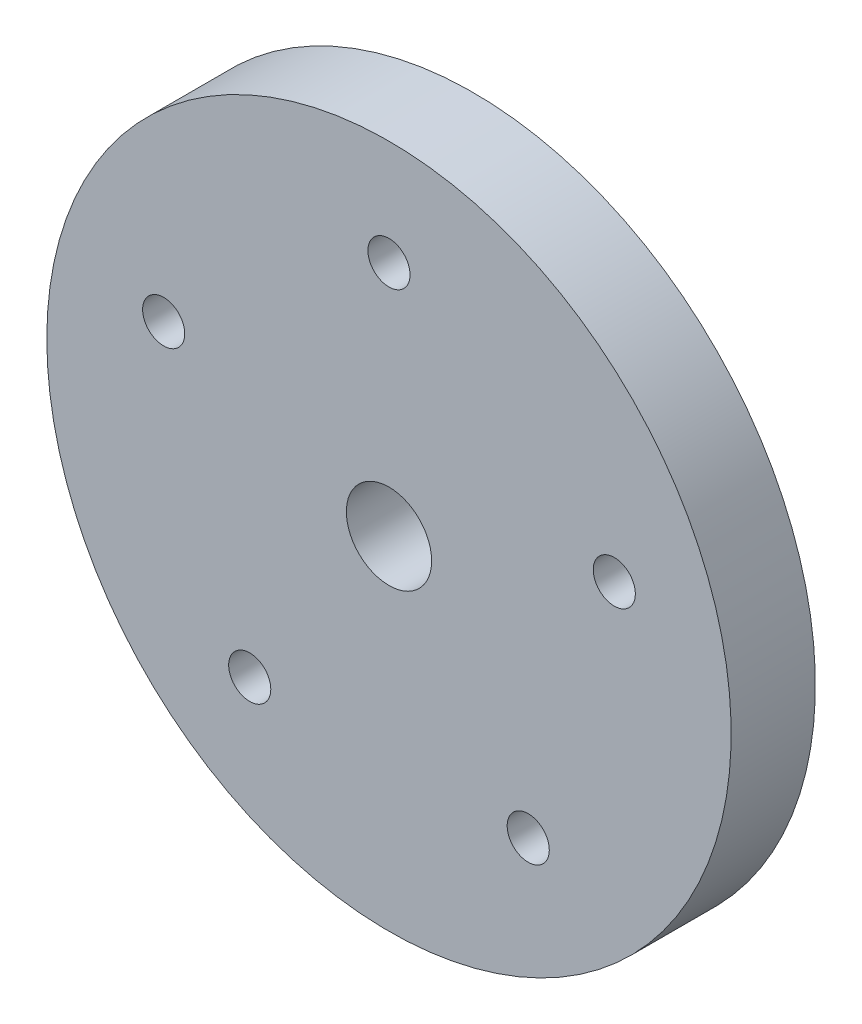
from build123d import *

# Parameters (mm, degrees)
F_4_0_4_HEAT_INSERT_M3_D         = 4
F_8_1_8_1_DURCHMESSER_BOHRUNG1_D = 8.1
SKIZZE8_R                        = 1.2
SCHNITT_LINEAR_AUSTRAGEN1_DEPTH  = 7
KREISMUSTER1_COUNT               = 5


with BuildPart() as part:
    # Skizze1 → Rotation1 (revolve)
    with BuildSketch(Plane(origin=(0, 0, 0), x_dir=(0, 0, -1), z_dir=(1, 0, 0))):
        Polygon((0, 0), (20, 0), (20, 15), (8, 15), (8, 32.5), (0, 32.5), align=None)
    revolve(axis=Axis((0, 0, 0), (0, 0, 1)))

    # Ø4.0 (4) Heat Insert M3 (through all)
    with Locations(Plane.XY):
        with Locations((0, 22.5)):
            f_4_0_4_heat_insert_m3 = Hole(F_4_0_4_HEAT_INSERT_M3_D / 2)

    # Ø8.1 (8.1) Durchmesser Bohrung1 (through all)
    with Locations(Plane.XY):
        with Locations((0, 0)):
            Hole(F_8_1_8_1_DURCHMESSER_BOHRUNG1_D / 2)

    # Skizze8 → Schnitt-Linear austragen1 (cut)
    with BuildSketch(Plane(origin=(0, 0, -20), x_dir=(-1, 0, 0), z_dir=(0, 0, -1))):
        with Locations((0, 10)):
            Circle(SKIZZE8_R)
        with Locations((8.660254038, -5)):
            Circle(SKIZZE8_R)
        with Locations((-8.660254038, -5)):
            Circle(SKIZZE8_R)
    extrude(amount=-SCHNITT_LINEAR_AUSTRAGEN1_DEPTH, mode=Mode.SUBTRACT)

    # Kreismuster1: Ø4.0 (4) Heat Insert M3 ×5 about axis
    kreismuster1_axis = Axis((0, 0, 0), (0, 0, -1))
    for i in range(1, KREISMUSTER1_COUNT):
        add(f_4_0_4_heat_insert_m3.rotate(kreismuster1_axis, i * 360 / KREISMUSTER1_COUNT), mode=Mode.SUBTRACT)


solid = part.part
